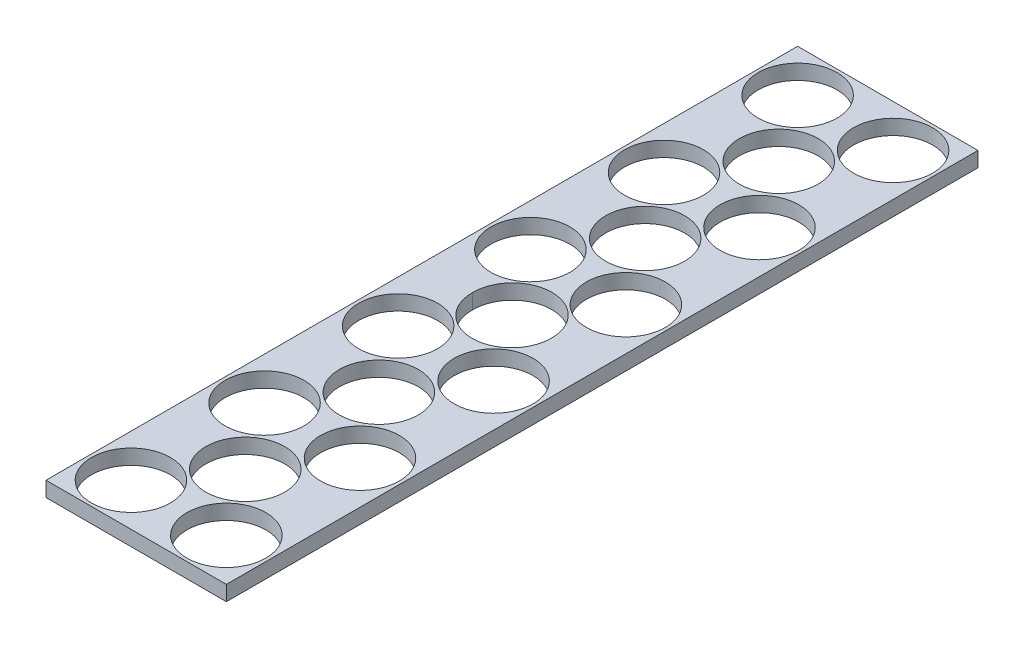
from build123d import *

# Parameters (mm, degrees)
SKETCH1_W               = 152.4
SKETCH1_H               = 12.7
BOSS_EXTRUDE1_DEPTH     = 317.5
CUT_EXTRUDE1_REACH      = 328.763
SKETCH2_R               = 33.3375
LPATTERN1_COUNT         = 3
LPATTERN1_PITCH         = 112.87125
MIRROR1_COPY_1_REACH    = 328.763
MIRROR1_COPY_1_SKETCH_R = 33.3375
MIRROR1_COPY_2_REACH    = 328.763
MIRROR1_COPY_2_SKETCH_R = 33.3375
MIRROR1_COPY_3_REACH    = 328.763
MIRROR1_COPY_3_SKETCH_R = 33.3375


with BuildPart() as part:
    # Sketch1 → Boss-Extrude1 (new, symmetric)
    with BuildSketch(Plane.XY):
        Rectangle(SKETCH1_W, SKETCH1_H)
    extrude(amount=BOSS_EXTRUDE1_DEPTH, both=True)

    # Sketch2 → Cut-Extrude1 (cut, up to next)
    with BuildSketch(Plane(origin=(0, 6.35, 0), x_dir=(1, 0, 0), z_dir=(0, 1, 0)), mode=Mode.PRIVATE) as cut_extrude1_sk1:
        with Locations((-40.3225, -281.6225)):
            Circle(SKETCH2_R)
    cut_extrude1_tool1 = extrude(cut_extrude1_sk1.sketch, amount=-CUT_EXTRUDE1_REACH, mode=Mode.PRIVATE) & part.part
    # Sketch2 → Cut-Extrude1 (cut, up to next)
    with BuildSketch(Plane(origin=(0, 6.35, 0), x_dir=(1, 0, 0), z_dir=(0, 1, 0)), mode=Mode.PRIVATE) as cut_extrude1_sk2:
        with Locations((0, -225.365836228)):
            Circle(SKETCH2_R)
    cut_extrude1_tool2 = extrude(cut_extrude1_sk2.sketch, amount=-CUT_EXTRUDE1_REACH, mode=Mode.PRIVATE) & part.part
    # Sketch2 → Cut-Extrude1 (cut, up to next)
    with BuildSketch(Plane(origin=(0, 6.35, 0), x_dir=(1, 0, 0), z_dir=(0, 1, 0)), mode=Mode.PRIVATE) as cut_extrude1_sk3:
        with Locations((40.3225, -281.6225)):
            Circle(SKETCH2_R)
    cut_extrude1_tool3 = extrude(cut_extrude1_sk3.sketch, amount=-CUT_EXTRUDE1_REACH, mode=Mode.PRIVATE) & part.part
    cut_extrude1_1 = cut_extrude1_tool1.solids().sort_by_distance((-40.3225, 6.35, 281.6225))[0]
    add(cut_extrude1_1, mode=Mode.SUBTRACT)
    cut_extrude1_2 = cut_extrude1_tool2.solids().sort_by_distance((0, 6.35, 225.365836))[0]
    add(cut_extrude1_2, mode=Mode.SUBTRACT)
    cut_extrude1_3 = cut_extrude1_tool3.solids().sort_by_distance((40.3225, 6.35, 281.6225))[0]
    add(cut_extrude1_3, mode=Mode.SUBTRACT)
    cut_extrude1 = cut_extrude1_1 + cut_extrude1_2 + cut_extrude1_3  # Cut-Extrude1 as one shape, for the pattern or mirror that repeats it

    # LPattern1: Cut-Extrude1 ×3
    with Locations(*[(0, 0, -i * LPATTERN1_PITCH) for i in range(1, LPATTERN1_COUNT)]):
        add(cut_extrude1, mode=Mode.SUBTRACT)

    # Mirror1 copy 1 sketch → Mirror1 copy 1 (cut, up to next)
    with BuildSketch(Plane(origin=(0, 6.35, 112.87125), x_dir=(1, 0, 0), z_dir=(0, 1, 0)), mode=Mode.PRIVATE) as mirror1_copy_1_sk1:
        with Locations((-40.3225, 281.6225)):
            Circle(MIRROR1_COPY_1_SKETCH_R)
    mirror1_copy_1_tool1 = extrude(mirror1_copy_1_sk1.sketch, amount=-MIRROR1_COPY_1_REACH, mode=Mode.PRIVATE) & part.part
    # Mirror1 copy 1 sketch → Mirror1 copy 1 (cut, up to next)
    with BuildSketch(Plane(origin=(0, 6.35, 112.87125), x_dir=(1, 0, 0), z_dir=(0, 1, 0)), mode=Mode.PRIVATE) as mirror1_copy_1_sk2:
        with Locations((0, 225.365836228)):
            Circle(MIRROR1_COPY_1_SKETCH_R)
    mirror1_copy_1_tool2 = extrude(mirror1_copy_1_sk2.sketch, amount=-MIRROR1_COPY_1_REACH, mode=Mode.PRIVATE) & part.part
    # Mirror1 copy 1 sketch → Mirror1 copy 1 (cut, up to next)
    with BuildSketch(Plane(origin=(0, 6.35, 112.87125), x_dir=(1, 0, 0), z_dir=(0, 1, 0)), mode=Mode.PRIVATE) as mirror1_copy_1_sk3:
        with Locations((40.3225, 281.6225)):
            Circle(MIRROR1_COPY_1_SKETCH_R)
    mirror1_copy_1_tool3 = extrude(mirror1_copy_1_sk3.sketch, amount=-MIRROR1_COPY_1_REACH, mode=Mode.PRIVATE) & part.part
    add(mirror1_copy_1_tool1.solids().sort_by_distance((-40.3225, 6.35, -168.75125))[0], mode=Mode.SUBTRACT)
    add(mirror1_copy_1_tool2.solids().sort_by_distance((0, 6.35, -112.494586))[0], mode=Mode.SUBTRACT)
    add(mirror1_copy_1_tool3.solids().sort_by_distance((40.3225, 6.35, -168.75125))[0], mode=Mode.SUBTRACT)

    # Mirror1 copy 2 sketch → Mirror1 copy 2 (cut, up to next)
    with BuildSketch(Plane(origin=(0, 6.35, 225.7425), x_dir=(1, 0, 0), z_dir=(0, 1, 0)), mode=Mode.PRIVATE) as mirror1_copy_2_sk1:
        with Locations((-40.3225, 281.6225)):
            Circle(MIRROR1_COPY_2_SKETCH_R)
    mirror1_copy_2_tool1 = extrude(mirror1_copy_2_sk1.sketch, amount=-MIRROR1_COPY_2_REACH, mode=Mode.PRIVATE) & part.part
    # Mirror1 copy 2 sketch → Mirror1 copy 2 (cut, up to next)
    with BuildSketch(Plane(origin=(0, 6.35, 225.7425), x_dir=(1, 0, 0), z_dir=(0, 1, 0)), mode=Mode.PRIVATE) as mirror1_copy_2_sk2:
        with Locations((0, 225.365836228)):
            Circle(MIRROR1_COPY_2_SKETCH_R)
    mirror1_copy_2_tool2 = extrude(mirror1_copy_2_sk2.sketch, amount=-MIRROR1_COPY_2_REACH, mode=Mode.PRIVATE) & part.part
    # Mirror1 copy 2 sketch → Mirror1 copy 2 (cut, up to next)
    with BuildSketch(Plane(origin=(0, 6.35, 225.7425), x_dir=(1, 0, 0), z_dir=(0, 1, 0)), mode=Mode.PRIVATE) as mirror1_copy_2_sk3:
        with Locations((40.3225, 281.6225)):
            Circle(MIRROR1_COPY_2_SKETCH_R)
    mirror1_copy_2_tool3 = extrude(mirror1_copy_2_sk3.sketch, amount=-MIRROR1_COPY_2_REACH, mode=Mode.PRIVATE) & part.part
    add(mirror1_copy_2_tool1.solids().sort_by_distance((-40.3225, 6.35, -55.88))[0], mode=Mode.SUBTRACT)
    add(mirror1_copy_2_tool2.solids().sort_by_distance((0, 6.35, 0.376664))[0], mode=Mode.SUBTRACT)
    add(mirror1_copy_2_tool3.solids().sort_by_distance((40.3225, 6.35, -55.88))[0], mode=Mode.SUBTRACT)

    # Mirror1 copy 3 sketch → Mirror1 copy 3 (cut, up to next)
    with BuildSketch(Plane(origin=(0, 6.35, 0), x_dir=(1, 0, 0), z_dir=(0, 1, 0)), mode=Mode.PRIVATE) as mirror1_copy_3_sk1:
        with Locations((-40.3225, 281.6225)):
            Circle(MIRROR1_COPY_3_SKETCH_R)
    mirror1_copy_3_tool1 = extrude(mirror1_copy_3_sk1.sketch, amount=-MIRROR1_COPY_3_REACH, mode=Mode.PRIVATE) & part.part
    # Mirror1 copy 3 sketch → Mirror1 copy 3 (cut, up to next)
    with BuildSketch(Plane(origin=(0, 6.35, 0), x_dir=(1, 0, 0), z_dir=(0, 1, 0)), mode=Mode.PRIVATE) as mirror1_copy_3_sk2:
        with Locations((0, 225.365836228)):
            Circle(MIRROR1_COPY_3_SKETCH_R)
    mirror1_copy_3_tool2 = extrude(mirror1_copy_3_sk2.sketch, amount=-MIRROR1_COPY_3_REACH, mode=Mode.PRIVATE) & part.part
    # Mirror1 copy 3 sketch → Mirror1 copy 3 (cut, up to next)
    with BuildSketch(Plane(origin=(0, 6.35, 0), x_dir=(1, 0, 0), z_dir=(0, 1, 0)), mode=Mode.PRIVATE) as mirror1_copy_3_sk3:
        with Locations((40.3225, 281.6225)):
            Circle(MIRROR1_COPY_3_SKETCH_R)
    mirror1_copy_3_tool3 = extrude(mirror1_copy_3_sk3.sketch, amount=-MIRROR1_COPY_3_REACH, mode=Mode.PRIVATE) & part.part
    add(mirror1_copy_3_tool1.solids().sort_by_distance((-40.3225, 6.35, -281.6225))[0], mode=Mode.SUBTRACT)
    add(mirror1_copy_3_tool2.solids().sort_by_distance((0, 6.35, -225.365836))[0], mode=Mode.SUBTRACT)
    add(mirror1_copy_3_tool3.solids().sort_by_distance((40.3225, 6.35, -281.6225))[0], mode=Mode.SUBTRACT)


solid = part.part
